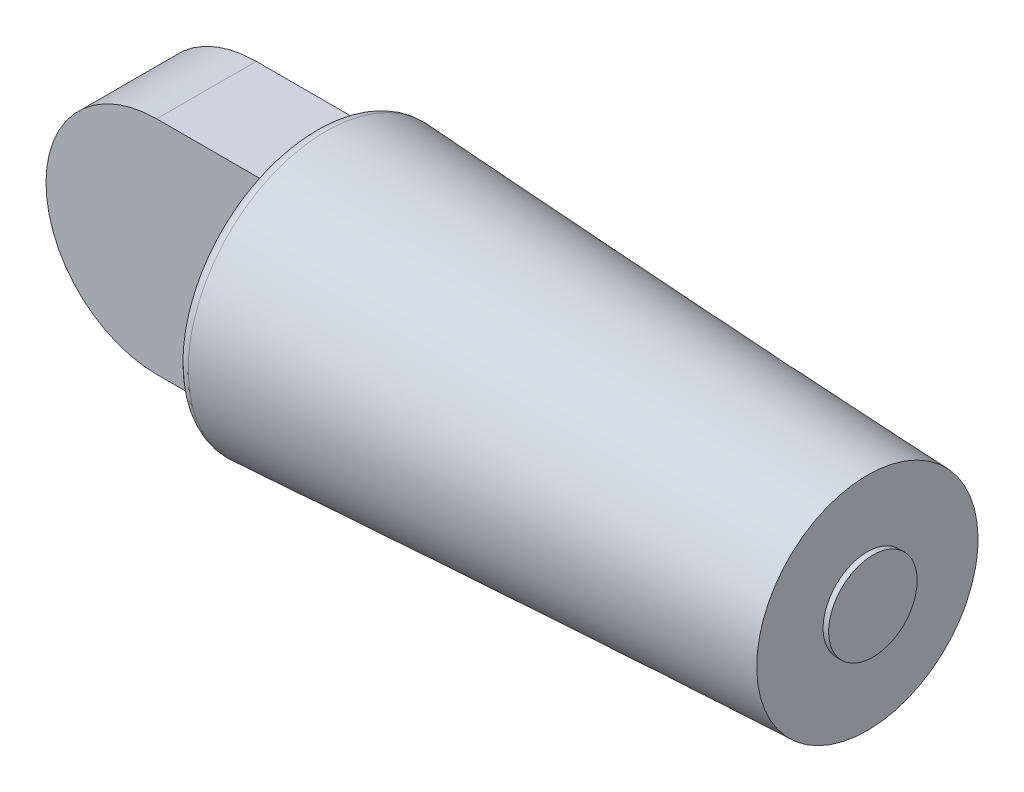
from build123d import *

# Parameters (mm, degrees)
SKETCH17_W          = 90
SKETCH17_H          = 200
BOSS_EXTRUDE2_DEPTH = 200
CUT_EXTRUDE14_DEPTH = 200
FILLET1_R           = 10
SKETCH22_R          = 40
BOSS_EXTRUDE3_DEPTH = 5


with BuildPart() as part:
    # Loft5: read off the stored shape, not the designer's step
    # Loft5: loft between two sections, ruled curve by curve
    loft5_from = [
        Edge.make_bspline([(0, 9.572476569, 124.632931813), (0, -239.693387057, 143.777884951), (0, -258.838340195, -105.487978675), (0, -9.572476569, -124.632931813), (0, 239.693387057, -143.777884951), (0, 258.838340195, 105.487978675), (0, 9.572476569, 124.632931813)], [0, 0, 0, 0, 0.5, 0.5, 0.5, 1, 1, 1, 1], 3, [1, 0.333333333, 0.333333333, 1, 0.333333333, 0.333333333, 1]),
    ]
    loft5_to = [
        Edge.make_bspline([(500, 33.637216162, 94.172913775), (500, -154.708611388, 161.447346099), (500, -221.983043712, -26.898481451), (500, -33.637216162, -94.172913775), (500, 154.708611388, -161.447346099), (500, 221.983043712, 26.898481451), (500, 33.637216162, 94.172913775)], [0, 0, 0, 0, 0.5, 0.5, 0.5, 1, 1, 1, 1], 3, [1, 0.333333333, 0.333333333, 1, 0.333333333, 0.333333333, 1]),
    ]
    loft5 = Solid(Shell([*[Face.make_surface_from_curves(loft5_from[k], loft5_to[k]) for k in range(1)], Face(Wire(loft5_from)), Face(Wire(loft5_to))]))
    add(loft5)

    # Sketch17 → Boss-Extrude2 (add)
    with BuildSketch(Plane.ZY):
        with Locations((-2.678768884, 0)):
            Rectangle(SKETCH17_W, SKETCH17_H)
    extrude(amount=BOSS_EXTRUDE2_DEPTH)

    # Sketch21 → Cut-Extrude14 (cut)
    with BuildSketch(Plane(origin=(0, 0, -47.678768884), x_dir=(-1, 0, 0), z_dir=(0, 0, -1))):
        with BuildLine():
            Line((100, 100), (100, 139.740536385))
            Line((100, 139.740536385), (237.040054467, 139.740536385))
            Line((237.040054467, 139.740536385), (237.040054467, -127.442216689))
            Line((237.040054467, -127.442216689), (100, -127.442216689))
            Line((100, -127.442216689), (100, -100))
            ThreePointArc((100, -100), (200, 0), (100, 100))
        make_face()
    extrude(amount=-CUT_EXTRUDE14_DEPTH, mode=Mode.SUBTRACT)

    # Fillet1
    fillet1_edges = [part.edges().sort_by_distance(p)[0] for p in [
        (0, -9.572476569, -124.632931813),
    ]]
    fillet(fillet1_edges, radius=FILLET1_R)

    # Sketch22 → Boss-Extrude3 (add)
    with BuildSketch(Plane(origin=(500, 0, 0), x_dir=(0, 0, -1), z_dir=(1, 0, 0))):
        Circle(SKETCH22_R)
    extrude(amount=BOSS_EXTRUDE3_DEPTH)


solid = part.part
